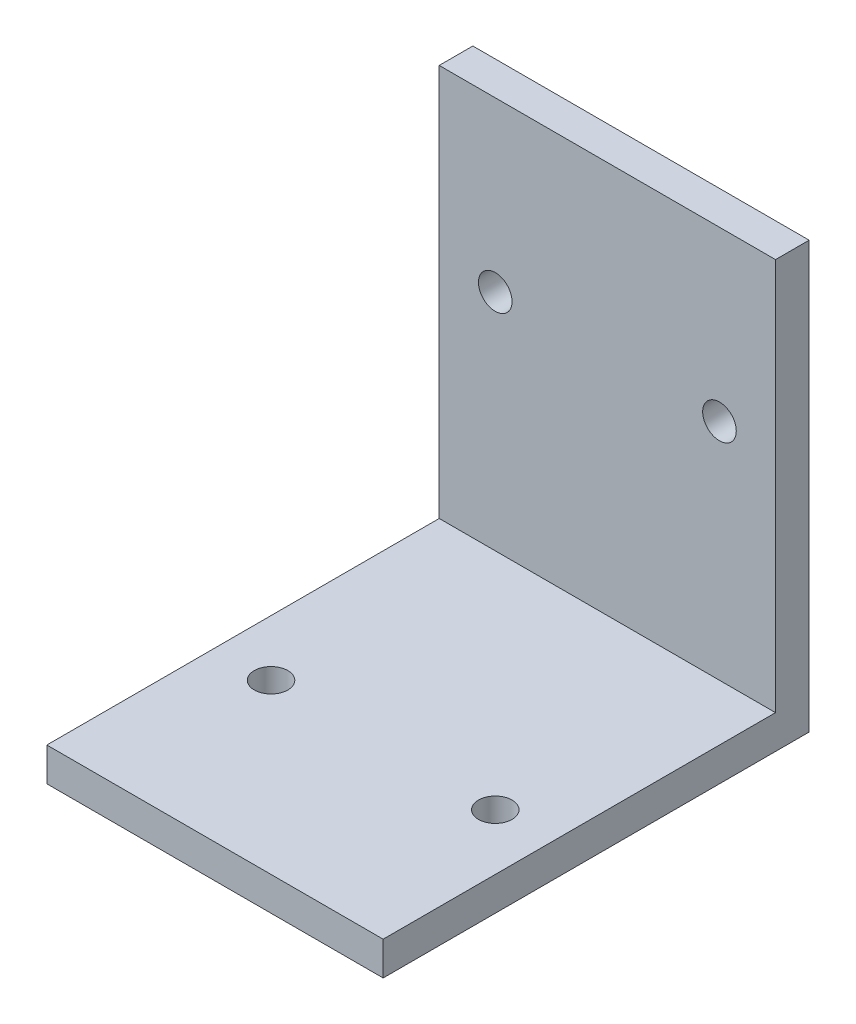
from build123d import *

# Parameters (mm, degrees)
SKETCH_1_W          = 30
SKETCH_1_H          = 38
EXTRUDE_1_DEPTH     = 3
SKETCH_2_W          = 30
SKETCH_2_H          = 3
EXTRUDE_2_DEPTH     = 35
SKETCH_3_R          = 1.5
CUT_EXTRUDE_1_DEPTH = 35
SKETCH_4_R          = 1.5
CUT_EXTRUDE_2_DEPTH = 35


with BuildPart() as part:
    # 草图1 → 凸台-拉伸1 (new body)
    with BuildSketch(Plane.XY):
        Rectangle(SKETCH_1_W, SKETCH_1_H)
    extrude(amount=EXTRUDE_1_DEPTH)

    # 草图2 → 凸台-拉伸2 (add)
    with BuildSketch(Plane.XY.offset(3)):
        with Locations((0, -17.5)):
            Rectangle(SKETCH_2_W, SKETCH_2_H)
    extrude(amount=EXTRUDE_2_DEPTH)

    # 草图3 → 切除-拉伸1 (cut)
    with BuildSketch(Plane.XY.offset(3)):
        with Locations((-10, 4)):
            Circle(SKETCH_3_R)
        with Locations((10, 4)):
            Circle(SKETCH_3_R)
    extrude(amount=-CUT_EXTRUDE_1_DEPTH, mode=Mode.SUBTRACT)

    # 草图4 → 切除-拉伸2 (cut)
    with BuildSketch(Plane(origin=(0, -16, 0), x_dir=(1, 0, 0), z_dir=(0, 1, 0))):
        with Locations((-10, -23)):
            Circle(SKETCH_4_R)
        with Locations((10, -23)):
            Circle(SKETCH_4_R)
    extrude(amount=-CUT_EXTRUDE_2_DEPTH, mode=Mode.SUBTRACT)


solid = part.part
